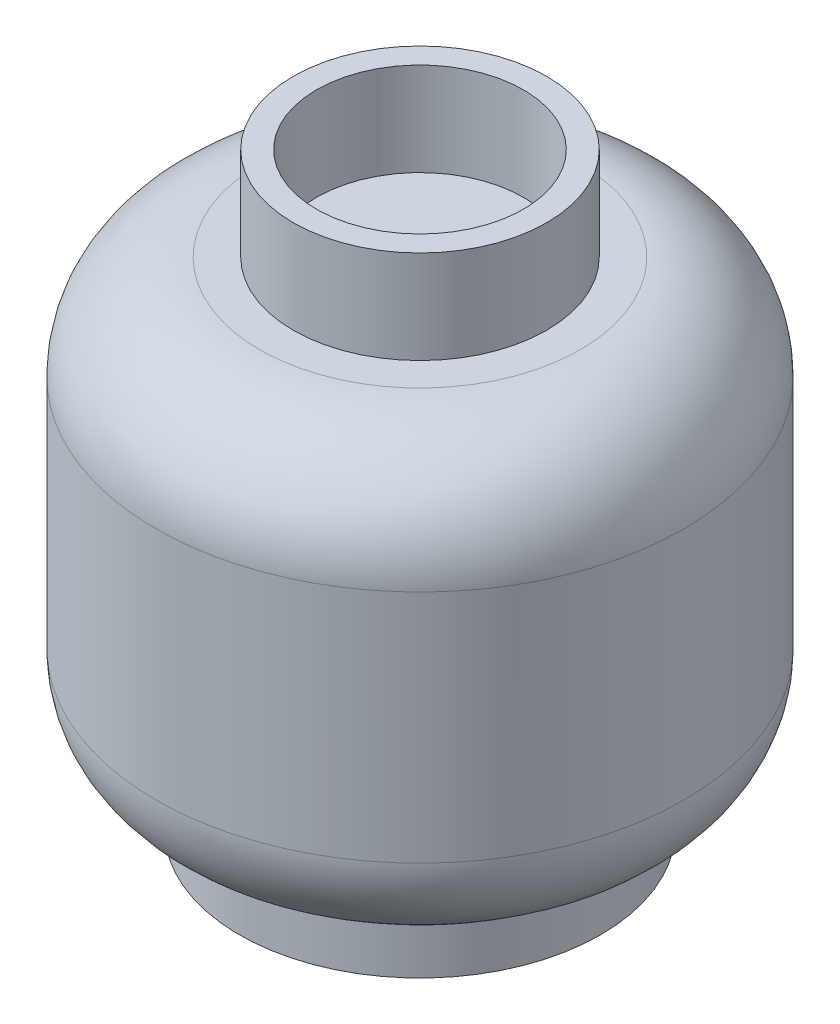
from build123d import *

# Parameters (mm, degrees)
FILLET1_R          = 2
SKETCH3_R          = 2.5
CUT_EXTRUDE1_DEPTH = 6
SKETCH4_R          = 2
CUT_EXTRUDE2_DEPTH = 1.8


with BuildPart() as part:
    # Sketch2 → Revolve2 (revolve)
    with BuildSketch(Plane.XY):
        Polygon((0, -5.7), (0, 5.7), (2.45, 5.7), (2.45, 3.9), (5.1, 3.9), (5.1, -4.6), (3.489000018, -4.6), (3.489000018, -5.7), align=None)
    revolve(axis=Axis((0, -5.7, 0), (0, 1, 0)))

    # Fillet1
    # the kernel refuses this fillet: 2 mm, written as the material it takes off along each edge
    with BuildSketch(Plane(origin=(0, -4.6, 0), x_dir=(1, 0, 0), z_dir=(0, 0, 1))) as fillet1_piece_1:
        with BuildLine():
            CenterArc((3.1, 1.961805033), FILLET1_R, 281.215517004, 78.784482996)
            Line((3.489000018, 0), (3.496780019, -0.039236101))
            ThreePointArc((3.496780019, -0.039236101), (4.294500009, -0.04), (5.1, -0.04))
            Line((5.1, -0.04), (5.14, 0))
            Line((5.14, 0), (5.14, 1.961805033))
            Line((5.14, 1.961805033), (5.1, 1.961805033))
        make_face()
    revolve(axis=Axis((0, -4.6, 0), (0, 1, 0)), mode=Mode.SUBTRACT)
    with BuildSketch(Plane(origin=(0, 3.9, 0), x_dir=(1, 0, 0), z_dir=(0, 0, 1))) as fillet1_piece_2:
        with BuildLine():
            CenterArc((5.1 - FILLET1_R, -FILLET1_R), FILLET1_R, 360, 90)
            Line((5.1, -FILLET1_R), (5.1 + FILLET1_R * 0.02, -FILLET1_R))
            Line((5.1 + FILLET1_R * 0.02, -FILLET1_R), (5.1 + FILLET1_R * 0.02, FILLET1_R * 0.02))
            Line((5.1 + FILLET1_R * 0.02, FILLET1_R * 0.02), (5.1 - FILLET1_R, FILLET1_R * 0.02))
            Line((5.1 - FILLET1_R, FILLET1_R * 0.02), (5.1 - FILLET1_R, 0))
        make_face()
    revolve(axis=Axis((0, 3.9, 0), (0, 1, 0)), mode=Mode.SUBTRACT)

    # Sketch3 → Cut-Extrude1 (cut)
    with BuildSketch(Plane.XZ.offset(5.7)):
        Circle(SKETCH3_R)
    extrude(amount=-CUT_EXTRUDE1_DEPTH, mode=Mode.SUBTRACT)

    # Sketch4 → Cut-Extrude2 (cut)
    with BuildSketch(Plane(origin=(0, 5.7, 0), x_dir=(1, 0, 0), z_dir=(0, 1, 0))):
        with Locations(Location((0, 0, 0), (0, 0, 180))):
            Circle(SKETCH4_R)
    extrude(amount=-CUT_EXTRUDE2_DEPTH, mode=Mode.SUBTRACT)


solid = part.part
